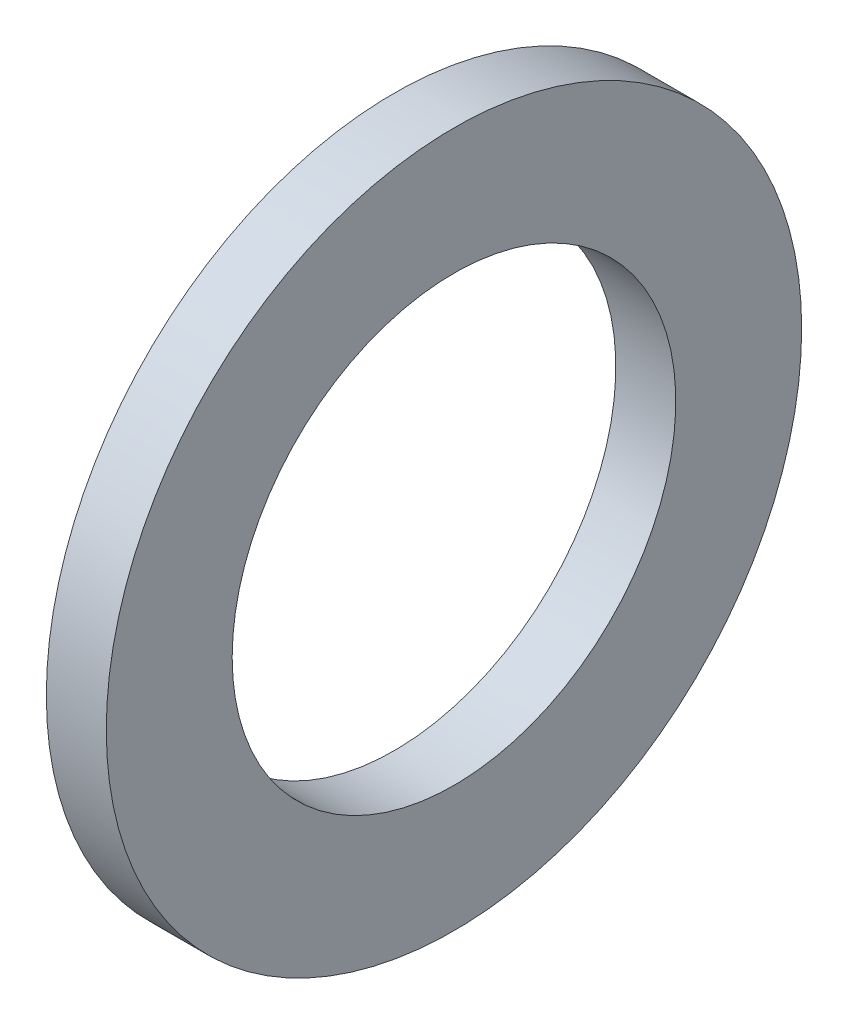
from build123d import *

# Parameters (mm, degrees)
SKETCH1_W = 5
SKETCH1_H = 10.5


with BuildPart() as part:
    # Sketch1 → Base-Revolve (revolve)
    with BuildSketch(Plane.XY):
        with Locations((-2.5, 23.75)):
            Rectangle(SKETCH1_W, SKETCH1_H)
    revolve(axis=Axis((-34.925, 0, 0), (1, 0, 0)))


solid = part.part
